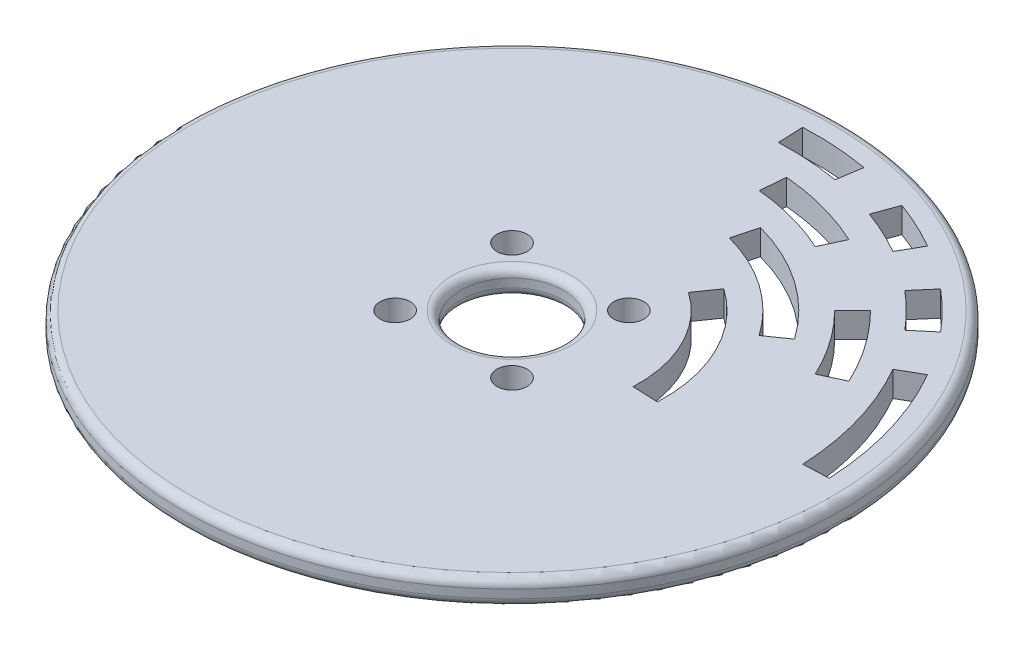
from build123d import *

# Parameters (mm, degrees)
SKETCH4_R           = 39
BOSS_EXTRUDE1_DEPTH = 3
CUT_EXTRUDE1_DEPTH  = 3
SKETCH1_R           = 6.096
SKETCH1_R_2         = 1.7859375
CUT_EXTRUDE3_DEPTH  = 3
FILLET1_R           = 1


with BuildPart() as part:
    # Sketch4 → Boss-Extrude1 (new body)
    with BuildSketch(Plane(origin=(0, 0, 0), x_dir=(1, 0, 0), z_dir=(0, 1, 0))):
        Circle(SKETCH4_R)
    extrude(amount=BOSS_EXTRUDE1_DEPTH)

    # Sketch3 → Cut-Extrude1 (cut)
    with BuildSketch(Plane(origin=(0, 0, 0), x_dir=(1, 0, 0), z_dir=(0, 1, 0))):
        with BuildLine():
            Line((32.968591312, 1.439439783), (35.965735977, 1.570297945))
            ThreePointArc((35.965735977, 1.570297945), (34.561794758, 10.073844505), (31.176914536, 18))
            Line((31.176914536, 18), (28.578838325, 16.5))
            ThreePointArc((28.578838325, 16.5), (31.681645195, 9.234357463), (32.968591312, 1.439439783))
        make_face()
        with BuildLine():
            Line((-1.570297945, 35.965735977), (-1.439439783, 32.968591312))
            ThreePointArc((-1.439439783, 32.968591312), (2.158303265, 32.929344467), (5.730389863, 32.498655849))
            Line((5.730389863, 32.498655849), (6.186823022, 35.464393705))
            ThreePointArc((6.186823022, 35.464393705), (2.321833751, 35.925048198), (-1.570297945, 35.965735977))
        make_face()
        with BuildLine():
            Line((12.31272516, 33.828934348), (11.28666473, 31.009856486))
            ThreePointArc((11.28666473, 31.009856486), (13.946402637, 29.908156972), (16.5, 28.578838325))
            Line((16.5, 28.578838325), (18, 31.176914536))
            ThreePointArc((18, 31.176914536), (15.214257423, 32.627080333), (12.31272516, 33.828934348))
        make_face()
        with BuildLine():
            Line((23.163459499, 27.558195587), (21.21199112, 25.279466623))
            ThreePointArc((21.21199112, 25.279466623), (23.334523779, 23.334523779), (25.279466623, 21.21199112))
            Line((25.279466623, 21.21199112), (27.577599952, 23.140353949))
            ThreePointArc((27.577599952, 23.140353949), (25.466509571, 25.445174203), (23.163459499, 27.558195587))
        make_face()
        with BuildLine():
            Line((14.985723324, -0.65429081), (17.982867988, -0.785148973))
            ThreePointArc((17.982867988, -0.785148973), (16.143709348, 7.961196424), (10.324375854, 14.744736797))
            Line((10.324375854, 14.744736797), (8.603646545, 12.287280664))
            ThreePointArc((8.603646545, 12.287280664), (13.453091123, 6.634330353), (14.985723324, -0.65429081))
        make_face()
        with BuildLine():
            Line((2.614672282, 29.885840943), (2.353205054, 26.897256848))
            ThreePointArc((2.353205054, 26.897256848), (6.988114218, 26.07999731), (11.410693067, 24.47031025))
            Line((11.410693067, 24.47031025), (12.678547852, 27.189233611))
            ThreePointArc((12.678547852, 27.189233611), (7.764571353, 28.977774789), (2.614672282, 29.885840943))
        make_face()
        with BuildLine():
            Line((21.213203436, 21.213203436), (19.091883092, 19.091883092))
            ThreePointArc((19.091883092, 19.091883092), (22.117105196, 15.486563781), (24.47031025, 11.410693067))
            Line((24.47031025, 11.410693067), (27.189233611, 12.678547852))
            ThreePointArc((27.189233611, 12.678547852), (24.574561329, 17.207293091), (21.213203436, 21.213203436))
        make_face()
        with BuildLine():
            Line((6.211657082, 23.182219831), (5.435199947, 20.284442352))
            ThreePointArc((5.435199947, 20.284442352), (12.045105163, 17.20219293), (17.20219293, 12.045105163))
            Line((17.20219293, 12.045105163), (19.659649063, 13.765834472))
            ThreePointArc((19.659649063, 13.765834472), (13.765834472, 19.659649063), (6.211657082, 23.182219831))
        make_face()
    extrude(amount=CUT_EXTRUDE1_DEPTH, mode=Mode.SUBTRACT)

    # Sketch1 → Cut-Extrude3 (cut)
    with BuildSketch(Plane(origin=(0, 0, 0), x_dir=(1, 0, 0), z_dir=(0, 1, 0))):
        Circle(SKETCH1_R)
        with Locations((6.914797213, 6.914797213)):
            Circle(SKETCH1_R_2)
        with Locations((6.914797213, -6.914797213)):
            Circle(SKETCH1_R_2)
        with Locations((-6.914797213, -6.914797213)):
            Circle(SKETCH1_R_2)
        with Locations((-6.914797213, 6.914797213)):
            Circle(SKETCH1_R_2)
    extrude(amount=CUT_EXTRUDE3_DEPTH, mode=Mode.SUBTRACT)

    # Fillet1
    fillet1_edges = [part.edges().sort_by_distance(p)[0] for p in [
        (-6.096, 0, 0),
        (-6.096, 3, 0),
        (-39, 3, 0),
        (-39, 0, 0),
    ]]
    fillet(fillet1_edges, radius=FILLET1_R)


solid = part.part
